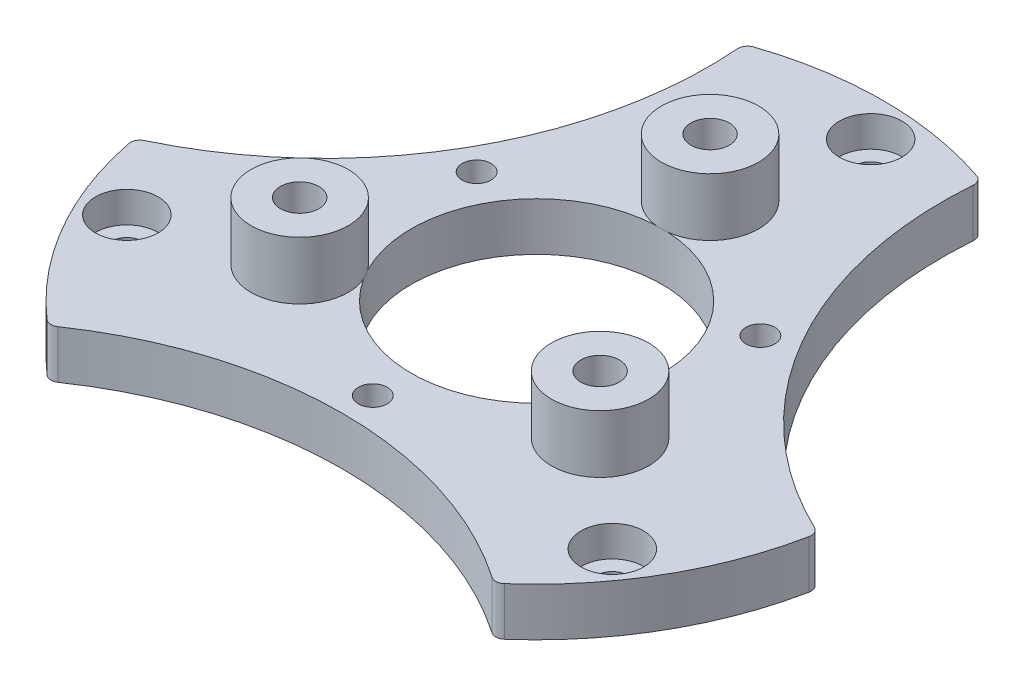
from build123d import *

# Parameters (mm, degrees)
SKETCH1_R           = 36
SKETCH1_R_2         = 13
BOSS_EXTRUDE1_DEPTH = 5
SKETCH2_R           = 1.65
CUT_EXTRUDE1_DEPTH  = 52.15662225
CIRPATTERN1_COUNT   = 3
SKETCH3_R           = 39.833252513
CUT_EXTRUDE2_DEPTH  = 10
CIRPATTERN2_COUNT   = 3
FILLET1_R           = 1
SKETCH4_R           = 5.05
BOSS_EXTRUDE2_DEPTH = 6
SKETCH7_R           = 3.25
CUT_EXTRUDE5_DEPTH  = 3.2
CIRPATTERN3_COUNT   = 3
SKETCH8_R           = 1.5
CUT_EXTRUDE6_DEPTH  = 10
SKETCH12_R          = 2
CUT_EXTRUDE8_DEPTH  = 52.623802313
CIRPATTERN4_COUNT   = 3


with BuildPart() as part:
    # Sketch1 → Boss-Extrude1 (new body)
    with BuildSketch(Plane(origin=(0, 0, 0), x_dir=(1, 0, 0), z_dir=(0, 1, 0))):
        Circle(SKETCH1_R)
        Circle(SKETCH1_R_2, mode=Mode.SUBTRACT)
    extrude(amount=BOSS_EXTRUDE1_DEPTH)

    # Sketch2 → Cut-Extrude1 (cut, through all)
    with BuildSketch(Plane(origin=(0, 5, 0), x_dir=(1, 0, 0), z_dir=(0, 1, 0))):
        with Locations((2.788983768, 31.878230339)):
            Circle(SKETCH2_R)
    cut_extrude1 = extrude(amount=-CUT_EXTRUDE1_DEPTH, mode=Mode.SUBTRACT)

    # CirPattern1: Cut-Extrude1 ×3 about axis
    cirpattern1_axis = Axis((0, 5, 0), (0, -1, 0))
    for i in range(1, CIRPATTERN1_COUNT):
        add(cut_extrude1.rotate(cirpattern1_axis, i * 360 / CIRPATTERN1_COUNT), mode=Mode.SUBTRACT)

    # Sketch3 → Cut-Extrude2 (cut)
    with BuildSketch(Plane(origin=(0, 5, 0), x_dir=(1, 0, 0), z_dir=(0, 1, 0))):
        with Locations((51.961524227, 30)):
            Circle(SKETCH3_R)
    cut_extrude2 = extrude(amount=-CUT_EXTRUDE2_DEPTH, mode=Mode.SUBTRACT)

    # CirPattern2: Cut-Extrude2 ×3 about axis
    cirpattern2_axis = Axis((0, 5, 0), (0, -1, 0))
    for i in range(1, CIRPATTERN2_COUNT):
        add(cut_extrude2.rotate(cirpattern2_axis, i * 360 / CIRPATTERN2_COUNT), mode=Mode.SUBTRACT)

    # Fillet1
    fillet1_edges = [part.edges().sort_by_distance(p)[0] for p in [
        (23.140353949, 2.5, 27.577599952),
        (-23.140353949, 2.5, 27.577599952),
        (-35.453079108, 2.5, 6.251334396),
        (-12.31272516, 2.5, -33.828934348),
        (35.453079108, 2.5, 6.251334396),
        (12.31272516, 2.5, -33.828934348),
    ]]
    fillet(fillet1_edges, radius=FILLET1_R)

    # Sketch4 → Boss-Extrude2 (add)
    with BuildSketch(Plane(origin=(0, 5, 0), x_dir=(1, 0, 0), z_dir=(0, 1, 0))):
        with Locations((0, 18)):
            Circle(SKETCH4_R)
    boss_extrude2 = extrude(amount=BOSS_EXTRUDE2_DEPTH)

    # Sketch7 → Cut-Extrude5 (cut)
    with BuildSketch(Plane(origin=(0, 5, 0), x_dir=(1, 0, 0), z_dir=(0, 1, 0))):
        with Locations((2.788983768, 31.878230339)):
            Circle(SKETCH7_R)
    cut_extrude5 = extrude(amount=-CUT_EXTRUDE5_DEPTH, mode=Mode.SUBTRACT)

    # CirPattern3: Boss-Extrude2, Cut-Extrude5 ×3 about axis
    cirpattern3_axis = Axis((0, 5, 0), (0, -1, 0))
    add([boss_extrude2.rotate(cirpattern3_axis, i * 360 / CIRPATTERN3_COUNT) for i in range(1, CIRPATTERN3_COUNT)])
    add([cut_extrude5.rotate(cirpattern3_axis, i * 360 / CIRPATTERN3_COUNT) for i in range(1, CIRPATTERN3_COUNT)], mode=Mode.SUBTRACT)

    # Sketch8 → Cut-Extrude6 (cut)
    with BuildSketch(Plane(origin=(0, 5, 0), x_dir=(1, 0, 0), z_dir=(0, 1, 0))):
        with Locations((14.722431864, 8.5)):
            Circle(SKETCH8_R)
    cut_extrude6 = extrude(amount=-CUT_EXTRUDE6_DEPTH, mode=Mode.SUBTRACT)

    # Sketch12 → Cut-Extrude8 (cut, through all)
    with BuildSketch(Plane(origin=(0, 11, 0), x_dir=(1, 0, 0), z_dir=(0, 1, 0))):
        with Locations((0, 18)):
            Circle(SKETCH12_R)
    cut_extrude8 = extrude(amount=-CUT_EXTRUDE8_DEPTH, mode=Mode.SUBTRACT)

    # CirPattern4: Cut-Extrude6, Cut-Extrude8 ×3 about axis
    cirpattern4_axis = Axis((0, 5, 0), (0, -1, 0))
    add([cut_extrude6.rotate(cirpattern4_axis, i * 360 / CIRPATTERN4_COUNT) for i in range(1, CIRPATTERN4_COUNT)], mode=Mode.SUBTRACT)
    add([cut_extrude8.rotate(cirpattern4_axis, i * 360 / CIRPATTERN4_COUNT) for i in range(1, CIRPATTERN4_COUNT)], mode=Mode.SUBTRACT)


solid = part.part
